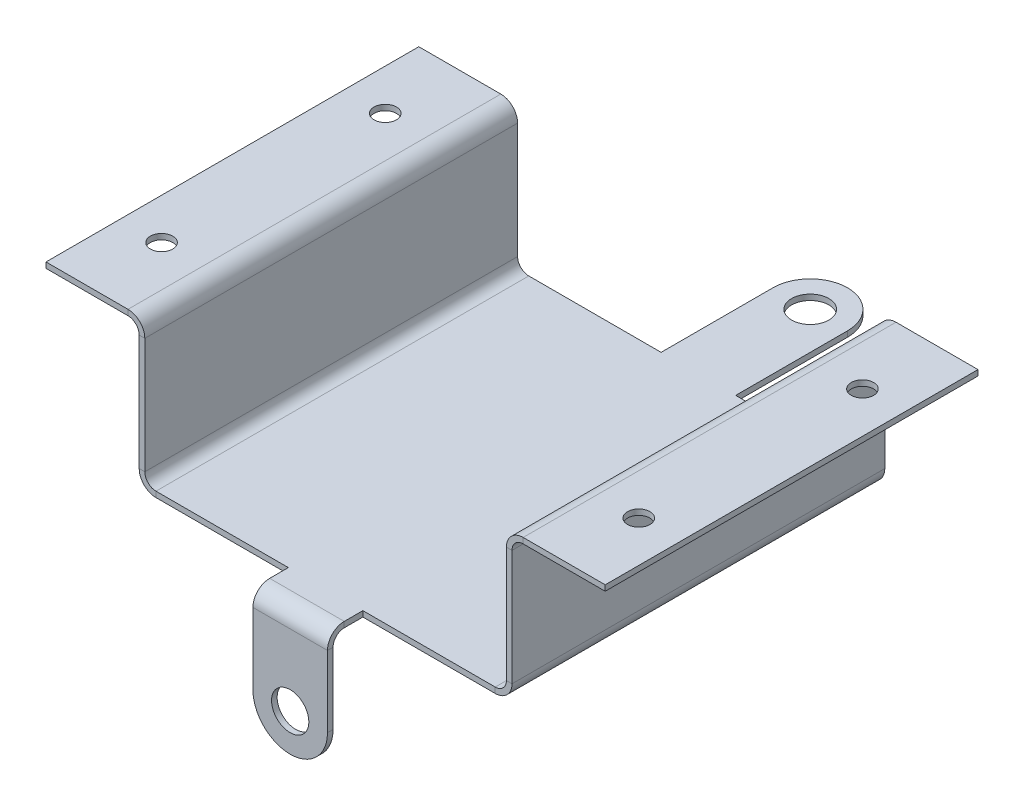
from build123d import *

# Parameters (mm, degrees)
SKETCH1_R                      = 5
BASE_FLANGE1_DEPTH             = 1.5
EDGE_FLANGE1_STRIP_W           = 12
EDGE_FLANGE1_STRIP_H           = 1.5
EDGE_FLANGE1_STRIP_CUT_DEPTH   = 100
EDGE_FLANGE1_STRIP_2_W         = 12
EDGE_FLANGE1_STRIP_2_H         = 1.5
EDGE_FLANGE1_STRIP_CUT_2_DEPTH = 100
EDGE_FLANGE1_DEPTH             = 100
EDGE_FLANGE1_BEND_DEPTH        = 100
EDGE_FLANGE2_STRIP_W           = 12
EDGE_FLANGE2_STRIP_H           = 1.5
EDGE_FLANGE2_STRIP_CUT_DEPTH   = 100
EDGE_FLANGE2_STRIP_2_W         = 12
EDGE_FLANGE2_STRIP_2_H         = 1.5
EDGE_FLANGE2_STRIP_CUT_2_DEPTH = 100
EDGE_FLANGE2_DEPTH             = 100
EDGE_FLANGE2_BEND_DEPTH        = 100
SKETCHED_START                 = 58.9178
SKETCHED_BEND1_OUTLINE_W       = 20
SKETCHED_BEND1_OUTLINE_H       = 1.5
SKETCHED_BEND1_DEPTH           = 32.0822
SKETCHED_START_2               = 56.266894772
SKETCHED_BEND1_2_OUTLINE_R     = 5
SKETCHED_BEND1_2_DEPTH         = 3.233105228
SKETCHED_START_3               = -10
SKETCHED_BEND1_3_DEPTH         = 20
SKETCHED_BEND1_4_DEPTH         = 20
SKETCH21_R                     = 3
CUT_EXTRUDE1_DEPTH             = 10


with BuildPart() as part:
    # Base-Flange1: sheet metal written as solids
    # Sketch1 → Base-Flange1 (new body)
    with BuildSketch(Plane(origin=(0, 0, 0), x_dir=(1, 0, 0), z_dir=(0, 1, 0))):
        with BuildLine():
            Line((10, 50), (10, 80))
            ThreePointArc((10, 80), (0, 90), (-10, 80))
            Line((-10, 80), (-10, 50))
            Line((-10, 50), (-50, 50))
            Line((-50, 50), (-50, -50))
            Line((-50, -50), (-10, -50))
            Line((-10, -50), (-10, -80))
            ThreePointArc((-10, -80), (0, -90), (10, -80))
            Line((10, -80), (10, -50))
            Line((10, -50), (50, -50))
            Line((50, -50), (50, 50))
            Line((50, 50), (10, 50))
        make_face()
        with Locations(Location((0, 80, 0), (0, 0, 270))):
            Circle(SKETCH1_R, mode=Mode.SUBTRACT)
        with Locations(Location((0, -80, 0), (0, 0, 270))):
            Circle(SKETCH1_R, mode=Mode.SUBTRACT)
    extrude(amount=-BASE_FLANGE1_DEPTH)

    # Edge-Flange1: sheet metal written as solids
    # Edge-Flange1 strip (on a plane across the edge) → Edge-Flange1 strip cut (cut)
    with BuildSketch(Plane(origin=(-50, 0, -50), x_dir=(1, 0, 0), z_dir=(0, 0, 1))):
        with Locations((-1.5, -0.75)):
            Rectangle(EDGE_FLANGE1_STRIP_W, EDGE_FLANGE1_STRIP_H)
    extrude(amount=EDGE_FLANGE1_STRIP_CUT_DEPTH, mode=Mode.SUBTRACT)

    # Edge-Flange1 strip 2 (on a plane across the edge) → Edge-Flange1 strip cut 2 (cut)
    with BuildSketch(Plane(origin=(50, 0, 50), x_dir=(-1, 0, 0), z_dir=(0, 0, -1))):
        with Locations((-1.5, -0.75)):
            Rectangle(EDGE_FLANGE1_STRIP_2_W, EDGE_FLANGE1_STRIP_2_H)
    extrude(amount=EDGE_FLANGE1_STRIP_CUT_2_DEPTH, mode=Mode.SUBTRACT)

    # Edge-Flange1 section (on a plane across the edge) → Edge-Flange1 (add)
    with BuildSketch(Plane(origin=(-50, 0, -50), x_dir=(1, 0, 0), z_dir=(0, 0, 1))):
        with BuildLine():
            Line((0, 3), (0, 38.5))
            Line((0, 38.5), (1.5, 38.5))
            Line((1.5, 38.5), (1.5, 3))
            ThreePointArc((1.5, 3), (2.378679656, 0.878679656), (4.5, 0))
            Line((4.5, 0), (4.5, -1.5))
            ThreePointArc((4.5, -1.5), (1.318019485, -0.181980515), (0, 3))
        make_face()
    extrude(amount=EDGE_FLANGE1_DEPTH)

    # Edge-Flange1 section 2 (on a plane across the edge) → Edge-Flange1 bend (add)
    with BuildSketch(Plane(origin=(50, 0, 50), x_dir=(-1, 0, 0), z_dir=(0, 0, -1))):
        with BuildLine():
            Line((0, 3), (0, 38.5))
            Line((0, 38.5), (1.5, 38.5))
            Line((1.5, 38.5), (1.5, 3))
            ThreePointArc((1.5, 3), (2.378679656, 0.878679656), (4.5, 0))
            Line((4.5, 0), (4.5, -1.5))
            ThreePointArc((4.5, -1.5), (1.318019485, -0.181980515), (0, 3))
        make_face()
    extrude(amount=EDGE_FLANGE1_BEND_DEPTH)

    # Edge-Flange2: sheet metal written as solids
    # Edge-Flange2 strip (on a plane across the edge) → Edge-Flange2 strip cut (cut)
    with BuildSketch(Plane(origin=(-50, 38.5, 50), x_dir=(0, -1, 0), z_dir=(0, 0, -1))):
        with Locations((-1.5, -0.75)):
            Rectangle(EDGE_FLANGE2_STRIP_W, EDGE_FLANGE2_STRIP_H)
    extrude(amount=EDGE_FLANGE2_STRIP_CUT_DEPTH, mode=Mode.SUBTRACT)

    # Edge-Flange2 strip 2 (on a plane across the edge) → Edge-Flange2 strip cut 2 (cut)
    with BuildSketch(Plane(origin=(50, 38.5, -50), x_dir=(0, -1, 0), z_dir=(0, 0, 1))):
        with Locations((-1.5, -0.75)):
            Rectangle(EDGE_FLANGE2_STRIP_2_W, EDGE_FLANGE2_STRIP_2_H)
    extrude(amount=EDGE_FLANGE2_STRIP_CUT_2_DEPTH, mode=Mode.SUBTRACT)

    # Edge-Flange2 section (on a plane across the edge) → Edge-Flange2 (add)
    with BuildSketch(Plane(origin=(-50, 38.5, 50), x_dir=(0, -1, 0), z_dir=(0, 0, -1))):
        with BuildLine():
            Line((0, 3), (0, 25))
            Line((0, 25), (1.5, 25))
            Line((1.5, 25), (1.5, 3))
            ThreePointArc((1.5, 3), (2.378679656, 0.878679656), (4.5, 0))
            Line((4.5, 0), (4.5, -1.5))
            ThreePointArc((4.5, -1.5), (1.318019485, -0.181980515), (0, 3))
        make_face()
    extrude(amount=EDGE_FLANGE2_DEPTH)

    # Edge-Flange2 section 2 (on a plane across the edge) → Edge-Flange2 bend (add)
    with BuildSketch(Plane(origin=(50, 38.5, -50), x_dir=(0, -1, 0), z_dir=(0, 0, 1))):
        with BuildLine():
            Line((0, 3), (0, 25))
            Line((0, 25), (1.5, 25))
            Line((1.5, 25), (1.5, 3))
            ThreePointArc((1.5, 3), (2.378679656, 0.878679656), (4.5, 0))
            Line((4.5, 0), (4.5, -1.5))
            ThreePointArc((4.5, -1.5), (1.318019485, -0.181980515), (0, 3))
        make_face()
    extrude(amount=EDGE_FLANGE2_BEND_DEPTH)

    # Sketched Bend1: read off the stored shape, not the designer's step
    # Sketched Bend1 outline → Sketched Bend1 (cut)
    with BuildSketch(Plane.XY.offset(SKETCHED_START)):
        with Locations((0, -0.75)):
            Rectangle(SKETCHED_BEND1_OUTLINE_W, SKETCHED_BEND1_OUTLINE_H)
    extrude(amount=SKETCHED_BEND1_DEPTH, mode=Mode.SUBTRACT)

    # Sketched Bend1 2 outline → Sketched Bend1 2 (add)
    with BuildSketch(Plane.XY.offset(SKETCHED_START_2)):
        with BuildLine():
            Line((10, -23.609513775), (10, -1.5))
            Line((10, -1.5), (-10, -1.5))
            Line((-10, -1.5), (-10, -23.609513775))
            ThreePointArc((-10, -23.609513775), (0, -33.609513775), (10, -23.609513775))
        make_face()
        with Locations((0, -23.609513775)):
            Circle(SKETCHED_BEND1_2_OUTLINE_R, mode=Mode.SUBTRACT)
    extrude(amount=SKETCHED_BEND1_2_DEPTH)

    # Sketched Bend1 3 outline → Sketched Bend1 3 (cut)
    with BuildSketch(Plane.YZ.offset(SKETCHED_START_3)):
        with BuildLine():
            ThreePointArc((-1.780629183, 56.266894772), (-2.887654552, 57.529889753), (-4.5, 58))
            Line((-4.5, 58), (-35, 58))
            Line((-35, 58), (-35, 56.266894772))
            Line((-35, 56.266894772), (-1.780629183, 56.266894772))
        make_face()
        with BuildLine():
            Line((1, 54), (1, 58.9178))
            Line((1, 58.9178), (-1.5, 58.9178))
            Line((-1.5, 58.9178), (-1.5, 61))
            Line((-1.5, 61), (-35, 61))
            Line((-35, 61), (-35, 59.500000008))
            Line((-35, 59.500000008), (-4.5, 59.5))
            ThreePointArc((-4.5, 59.5), (-1.318019485, 58.181980515), (0, 55))
            Line((0, 55), (0, 54))
            Line((0, 54), (1, 54))
        make_face()
    extrude(amount=SKETCHED_BEND1_3_DEPTH, mode=Mode.SUBTRACT)

    # Sketched Bend1 4 outline → Sketched Bend1 4 (add)
    with BuildSketch(Plane.YZ.offset(SKETCHED_START_3)):
        with BuildLine():
            Line((-0.182016948, 56.266894772), (-1.780629183, 56.266894772))
            ThreePointArc((-1.780629183, 56.266894772), (-1.570997401, 55.6488018), (-1.5, 55))
            Line((-1.5, 55), (-1.500000001, 54))
            Line((-1.500000001, 54), (0, 54))
            Line((0, 54), (0, 55))
            ThreePointArc((0, 55), (-0.045736664, 55.639951665), (-0.182016948, 56.266894772))
        make_face()
    extrude(amount=SKETCHED_BEND1_4_DEPTH)

    # Sketch21 → Cut-Extrude1 (cut)
    with BuildSketch(Plane(origin=(0, 38.5, 0), x_dir=(1, 0, 0), z_dir=(0, 1, 0))):
        with Locations(Location((-64, 30, 0), (0, 0, 270))):
            Circle(SKETCH21_R)
        with Locations(Location((-64, -30, 0), (0, 0, 270))):
            Circle(SKETCH21_R)
        with Locations(Location((64, 30, 0), (0, 0, 270))):
            Circle(SKETCH21_R)
        with Locations(Location((64, -30, 0), (0, 0, 270))):
            Circle(SKETCH21_R)
    extrude(amount=-CUT_EXTRUDE1_DEPTH, mode=Mode.SUBTRACT)


solid = part.part
